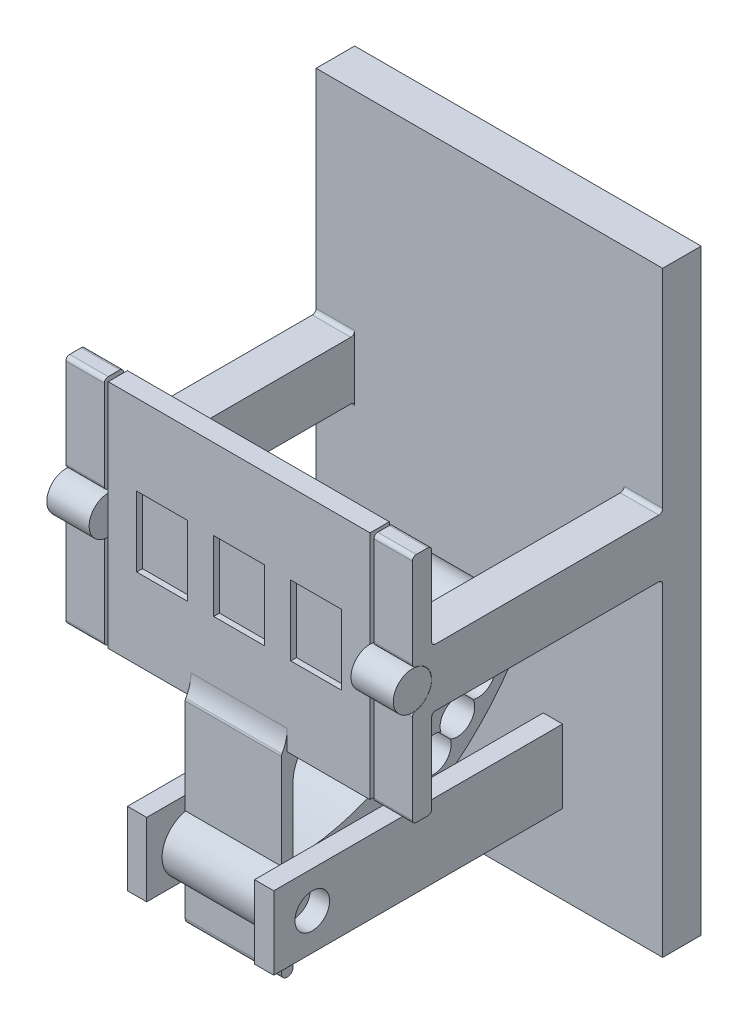
from build123d import *

# Parameters (mm, degrees)
SKETCH1_W               = 125.00000000000001
SKETCH1_H               = 90
BOSS_EXTRUDE1_DEPTH     = 10
BOSS_EXTRUDE2_DEPTH     = 35
BOSS_EXTRUDE3_DEPTH     = 45
CUT_EXTRUDE3_DEPTH      = 113.0267825120404
CUT_EXTRUDE3_DEPTH_BACK = 113.0267825120404
SKETCH11_W              = 89.99999999999999
SKETCH11_H              = 29.999999999999993
BOSS_EXTRUDE5_DEPTH     = 10
SKETCH13_W              = 68
SKETCH13_H              = 60.00000000000001
BOSS_EXTRUDE6_DEPTH     = 65
CUT_EXTRUDE6_DEPTH      = 151.5199322349037
CUT_EXTRUDE6_DEPTH_BACK = 151.5199322349037
SKETCH14_W              = 68
SKETCH14_H              = 59.999999999999986
SKETCH15_R              = 4.9499999999999975
BOSS_EXTRUDE8_DEPTH     = 11
CUT_EXTRUDE7_DEPTH      = 128.30377056474015
CUT_EXTRUDE7_DEPTH_BACK = 1.5
SKETCH17_W              = 13.199999999999998
SKETCH17_H              = 18.2
SKETCH19_R              = 4.499999999999999
BOSS_EXTRUDE10_DEPTH    = 12.5
BOSS_EXTRUDE12_DEPTH    = 12.5
BOSS_EXTRUDE13_DEPTH    = 75
SKETCH22_R              = 4.500000000000005
CUT_EXTRUDE8_DEPTH      = 75
FILLET1_R               = 10
FILLET5_R               = 1
BOSS_EXTRUDE14_DEPTH    = 12.5
BOSS_EXTRUDE16_REACH    = 167.349
SKETCH24_W              = 25.000000000000004
SKETCH24_H              = 3.000000000000014


with BuildPart() as part:
    # Sketch1 → Boss-Extrude1 (new body)
    with BuildSketch(Plane(origin=(0, 0, 0), x_dir=(0, 1, 0), z_dir=(0, 0, 1))):
        Rectangle(SKETCH1_W, SKETCH1_H)
    extrude(amount=BOSS_EXTRUDE1_DEPTH)

    # Sketch3 → Boss-Extrude2 (add, symmetric)
    with BuildSketch(Plane.YZ):
        with BuildLine():
            Line((5.916079783099619, 75), (7.5, 75))
            Line((7.5, 75), (29.144025452034434, 75))
            ThreePointArc((29.144025452034434, 75), (29.851132233220987, 74.70710678118655), (30.14402545203444, 74))
            Line((30.14402545203444, 74), (30.14402545203444, 71))
            ThreePointArc((30.14402545203444, 71), (29.851132233220998, 70.29289321881345), (29.144025452034434, 69.99999999999999))
            Line((29.144025452034434, 69.99999999999999), (8.500000000000007, 69.99999999999999))
            ThreePointArc((8.500000000000007, 69.99999999999999), (7.792893218813454, 69.70710678118654), (7.5, 68.99999999999999))
            Line((7.5, 68.99999999999999), (7.5, 0))
            Line((7.5, 0), (-7.5, 0))
            Line((-7.5, 0), (-7.5, 68.99999999999999))
            ThreePointArc((-7.5, 68.99999999999999), (-7.792893218813454, 69.70710678118654), (-8.500000000000007, 69.99999999999999))
            Line((-8.500000000000007, 69.99999999999999), (-29.144025452034434, 69.99999999999999))
            ThreePointArc((-29.144025452034434, 69.99999999999999), (-29.851132233220994, 70.29289321881345), (-30.14402545203444, 71))
            Line((-30.14402545203444, 71), (-30.14402545203444, 74))
            ThreePointArc((-30.14402545203444, 74), (-29.851132233220987, 74.70710678118655), (-29.144025452034434, 75))
            Line((-29.144025452034434, 75), (-7.5, 75))
            Line((-7.5, 75), (-5.916079783099619, 75))
            ThreePointArc((-5.916079783099619, 75), (-5.2705825587317126, 74.76376261582597), (-4.930066485916348, 74.16666666666666))
            ThreePointArc((-4.930066485916348, 74.16666666666666), (3.1e-16, 70), (4.930066485916348, 74.16666666666666))
            ThreePointArc((4.930066485916348, 74.16666666666666), (5.2705825587317126, 74.76376261582597), (5.916079783099619, 75))
        make_face()
    extrude(amount=BOSS_EXTRUDE2_DEPTH, both=True)

    # Sketch5 → Boss-Extrude3 (add, symmetric)
    with BuildSketch(Plane.YZ):
        with BuildLine():
            ThreePointArc((-7.5, 68.99999999999999), (-7.792893218813455, 69.70710678118654), (-8.500000000000007, 69.99999999999999))
            Line((-8.500000000000007, 69.99999999999999), (-29.144025452034434, 69.99999999999999))
            ThreePointArc((-29.144025452034434, 69.99999999999999), (-29.851132233220987, 70.29289321881345), (-30.14402545203444, 71))
            Line((-30.14402545203444, 71), (-30.14402545203444, 74))
            ThreePointArc((-30.14402545203444, 74), (-29.851132233220987, 74.70710678118655), (-29.14402545203444, 75))
            Line((-29.14402545203444, 75), (-5.916079783099619, 75))
            ThreePointArc((-5.916079783099619, 75), (-5.2705825587317126, 74.76376261582597), (-4.930066485916349, 74.16666666666666))
            ThreePointArc((-4.930066485916349, 74.16666666666666), (3.1e-16, 70), (4.930066485916347, 74.16666666666666))
            ThreePointArc((4.930066485916347, 74.16666666666666), (5.2705825587317126, 74.76376261582597), (5.916079783099619, 75))
            Line((5.916079783099619, 75), (29.144025452034434, 75))
            ThreePointArc((29.144025452034434, 75), (29.851132233220987, 74.70710678118655), (30.14402545203444, 74))
            Line((30.14402545203444, 74), (30.14402545203444, 71))
            ThreePointArc((30.14402545203444, 71), (29.851132233220998, 70.29289321881345), (29.144025452034434, 69.99999999999999))
            Line((29.144025452034434, 69.99999999999999), (8.500000000000007, 69.99999999999999))
            ThreePointArc((8.500000000000007, 69.99999999999999), (7.792893218813454, 69.70710678118654), (7.499999999999999, 68.99999999999999))
            Line((7.499999999999999, 68.99999999999999), (7.5, 11.000000000000009))
            ThreePointArc((7.5, 11.000000000000009), (7.79289321881345, 10.292893218813452), (8.500000000000007, 10))
            Line((8.500000000000007, 10), (-8.500000000000007, 10))
            ThreePointArc((-8.500000000000007, 10), (-7.79289321881345, 10.292893218813452), (-7.5, 11.000000000000009))
            Line((-7.5, 11.000000000000009), (-7.5, 68.99999999999999))
        make_face()
    extrude(amount=BOSS_EXTRUDE3_DEPTH, both=True)

    # Sketch7 → Cut-Extrude3 (cut, two sides: drawn at the far end of the back side and taken through both)
    with BuildSketch(Plane(origin=(0, 7.5, 0), x_dir=(-1, 0, 0), z_dir=(0, 1, 0)).offset(-CUT_EXTRUDE3_DEPTH_BACK)):
        Polygon((-35.000000000000014, 11.000000000000009), (-1.421e-14, 11.000000000000009), (-1.388e-14, 68.99999999999999), (-35, 68.99999999999999), align=None)
        Polygon((-1.388e-14, 68.99999999999999), (-1.388e-14, 11.000000000000009), (35, 11.000000000000009), (34.99999999999999, 68.99999999999999), align=None)
        Polygon((-35.000000000000014, 10.000000000000002), (-1.421e-14, 10.000000000000002), (-1.388e-14, 11.000000000000009), (-35.000000000000014, 11.000000000000009), align=None)
        Polygon((-1.388e-14, 11.000000000000009), (-1.388e-14, 10), (34.999999999999986, 10.000000000000002), (34.99999999999999, 11.000000000000009), align=None)
        Polygon((-35, 68.99999999999999), (-1.421e-14, 68.99999999999999), (-1.388e-14, 75), (-35, 75), align=None)
        Polygon((-1.388e-14, 75), (-1.388e-14, 68.99999999999999), (34.99999999999999, 68.99999999999999), (34.99999999999999, 75.00000000000001), align=None)
    extrude(amount=CUT_EXTRUDE3_DEPTH + CUT_EXTRUDE3_DEPTH_BACK, mode=Mode.SUBTRACT)

    # Sketch11 → Boss-Extrude5 (add)
    with BuildSketch(Plane.XY.offset(10)):
        with Locations((-7.11e-15, -77.5)):
            Rectangle(SKETCH11_W, SKETCH11_H)
    extrude(amount=-BOSS_EXTRUDE5_DEPTH)

    # Sketch13 → Boss-Extrude6 (add)
    with BuildSketch(Plane.XY.offset(10)):
        Rectangle(SKETCH13_W, SKETCH13_H)
    extrude(amount=BOSS_EXTRUDE6_DEPTH)

    # Sketch14 → Cut-Extrude6 (cut, two sides: drawn at the far end of the back side and taken through both)
    with BuildSketch(Plane(origin=(0, 30, 0), x_dir=(-1, 0, 0), z_dir=(0, 1, 0)).offset(-CUT_EXTRUDE6_DEPTH_BACK)):
        with Locations((0, 39.99999999999999)):
            Rectangle(SKETCH14_W, SKETCH14_H)
    extrude(amount=CUT_EXTRUDE6_DEPTH + CUT_EXTRUDE6_DEPTH_BACK, mode=Mode.SUBTRACT)


with BuildPart() as cut_extrude6_piece_1:
    # of the separate pieces the step leaves, piece 1, a body of its own (cut_extrude6_pieces)
    add(part.part.solids().sort_by_distance((45, -8.5, 10))[0])

    # Sketch21 → Boss-Extrude13 (add)
    with BuildSketch(Plane.XY.offset(10)):
        Polygon((14, -67), (14, -58), (14, -53.00000000000001), (19, -53.00000000000001), (19, -72.00000000000001), (14, -72.00000000000001), align=None)
    boss_extrude13 = extrude(amount=BOSS_EXTRUDE13_DEPTH)

    # Sketch22 → Cut-Extrude8 (cut)
    with BuildSketch(Plane(origin=(14, 0, 0), x_dir=(0, -1, 0), z_dir=(-1, 0, 0))):
        with Locations(Location((62.5, 75, 0), (0, 0, 90))):
            Circle(SKETCH22_R)
    cut_extrude8 = extrude(amount=-CUT_EXTRUDE8_DEPTH, mode=Mode.SUBTRACT)

    # Mirror3: Boss-Extrude13, Cut-Extrude8 across plane
    add(boss_extrude13.mirror(Plane(origin=(0, 0, 0), x_dir=(0, 0, 1), z_dir=(1, 0, 0))))
    add(cut_extrude8.mirror(Plane(origin=(0, 0, 0), x_dir=(0, 0, 1), z_dir=(1, 0, 0))), mode=Mode.SUBTRACT)


with BuildPart() as cut_extrude6_piece_2:
    # of the separate pieces the step leaves, piece 2, a body of its own (cut_extrude6_pieces)
    add(part.part.solids().sort_by_distance((34, 30, 70))[0])

    # Sketch15 → Boss-Extrude8 (add)
    with BuildSketch(Plane.YZ.offset(34)):
        with Locations(Location((0, 75, 0), (0, 0, 180))):
            Circle(SKETCH15_R)
    boss_extrude8 = extrude(amount=BOSS_EXTRUDE8_DEPTH)

    # Mirror2: Boss-Extrude8 across plane
    add(boss_extrude8.mirror(Plane(origin=(0, 0, 0), x_dir=(0, 0, 1), z_dir=(1, 0, 0))))

    # Sketch17 → Cut-Extrude7 (cut, two sides: drawn at the far end of the back side and taken through both)
    with BuildSketch(Plane.XY.offset(75).offset(-CUT_EXTRUDE7_DEPTH_BACK)):
        with Locations((20, 0)):
            Rectangle(SKETCH17_W, SKETCH17_H)
        Rectangle(SKETCH17_W, SKETCH17_H)
        with Locations((-20, 0)):
            Rectangle(SKETCH17_W, SKETCH17_H)
    extrude(amount=CUT_EXTRUDE7_DEPTH + CUT_EXTRUDE7_DEPTH_BACK, mode=Mode.SUBTRACT)



with BuildPart() as body_3:
    # Sketch19 → Boss-Extrude10 (new, symmetric)
    with BuildSketch(Plane.YZ):
        with BuildLine():
            ThreePointArc((-27.500000000000195, 27.368602791855984), (-47.63139720814418, 47.5000000000001), (-54.999999999999986, 75))
            ThreePointArc((-54.99999999999999, 75), (-62.500000000000234, 82.5), (-70, 74.99999999999952))
            ThreePointArc((-70.00000000000001, 74.99999999999952), (-60.62177826491066, 39.999999999999915), (-35.00000000000025, 14.378221735089447))
            ThreePointArc((-35.00000000000025, 14.378221735089461), (-24.75480947161695, 17.1234122634727), (-27.5000000000002, 27.368602791855995))
        make_face()
        with BuildLine():
            ThreePointArc((-53.420151070749036, 39.305796220104114), (-57.549230355616196, 46.67156079895663), (-49.62658773652759, 43.75000000000031))
            ThreePointArc((-49.62658773652759, 43.75000000000031), (-49.79588035427119, 42.52730888231364), (-50.29102043398087, 41.396614466851425))
            ThreePointArc((-50.291020433980876, 41.39661446685144), (-46.66302296924606, 40.37505330604382), (-45.08458376820239, 36.95241068695523))
            ThreePointArc((-45.08458376820239, 36.95241068695523), (-45.18318093770394, 36.01557925938665), (-45.47465182317137, 35.11980068828845))
            ThreePointArc((-45.47465182317139, 35.119800688288485), (-41.50271984866162, 34.41221987284317), (-39.69417382415946, 30.805826175841016))
            ThreePointArc((-39.69417382415946, 30.805826175841016), (-39.740923028054816, 30.158866094388294), (-39.88019931171205, 29.5253481768289))
            ThreePointArc((-39.88019931171212, 29.52534817682898), (-35.59776738012861, 29.19011787523953), (-33.547589313045286, 25.415416231797977))
            ThreePointArc((-33.547589313045286, 25.415416231797977), (-33.56156005491885, 25.06109787885311), (-33.603385533149094, 24.708979566019387))
            ThreePointArc((-33.603385533149144, 24.70897956601943), (-29.052300623284896, 24.80025800141369), (-26.75000000000022, 20.87341226347273))
            ThreePointArc((-26.75000000000022, 20.87341226347273), (-31.604318352945057, 16.387383005346287), (-35.69420377989643, 21.579848929251266))
            ThreePointArc((-35.694203779896405, 21.579848929251252), (-40.787015743584554, 21.845326200487442), (-42.36156382549272, 26.695894230810016))
            ThreePointArc((-42.36156382549269, 26.695894230809987), (-47.37615433949895, 27.62384566050158), (-48.304105769190464, 32.63843617450786))
            ThreePointArc((-48.304105769190386, 32.63843617450779), (-53.154673799512956, 34.21298425641601), (-53.420151070749085, 39.30579622010416))
        make_face(mode=Mode.SUBTRACT)
        with Locations(Location((-62.5, 75, 0), (0, 0, 270))):
            Circle(SKETCH19_R, mode=Mode.SUBTRACT)
    extrude(amount=BOSS_EXTRUDE10_DEPTH, both=True)


with BuildPart() as cut_extrude6_piece_2_1:
    add(cut_extrude6_piece_2.part)

    add(body_3.part)  # Boss-Extrude12 merges body 3
    # Sketch20 → Boss-Extrude12 (add, symmetric)
    with BuildSketch(Plane.YZ):
        Polygon((-55.000000000000014, 74.9999999999996), (-30, 75), (-30, 76.49999999999999), (-55.000000000000014, 76.49999999999999), align=None)
        Polygon((-30, 73.49999999999999), (-30, 75), (-55.000000000000014, 74.9999999999996), (-55.000000000000014, 73.49999999999999), align=None)
    extrude(amount=BOSS_EXTRUDE12_DEPTH, both=True)

    # Fillet1
    # the kernel refuses this fillet: 10 mm, written as the material it adds along each edge
    with BuildSketch(Plane(origin=(-12.5, -30, 75), x_dir=(0, 1, 0), z_dir=(1, 0, 0))) as fillet1_piece_1:
        with BuildLine():
            CenterArc((5.267826876426348, 10), FILLET1_R, 238.21166938294851, 31.788330617051486)
            Line((0, 1.4999999999999858), (0, 0))
            Line((0, 0), (5.267826876426348, 0))
        make_face()
    extrude(amount=25)
    with BuildSketch(Plane(origin=(12.5, -30, 73.49999999999999), x_dir=(0, 0, -1), z_dir=(-1, 0, 0))) as fillet1_piece_2:
        with BuildLine():
            CenterArc((10, 7.599342076785334), FILLET1_R, 180, 49.45839812649547)
            Line((0, 7.599342076785334), (0, 0))
            Line((0, 0), (3.5, 0))
        make_face()
    extrude(amount=25)

    # Fillet5
    fillet5_edges = [cut_extrude6_piece_2_1.edges().sort_by_distance(p)[0] for p in [
        (0, -30, 76.49999999999999),
    ]]
    fillet(fillet5_edges, radius=FILLET5_R)

    # Sketch24 → Boss-Extrude16 (add, up to next)
    with BuildSketch(Plane(origin=(0, -72.00000000000001, 0), x_dir=(-1, 0, 0), z_dir=(0, 1, 0)), mode=Mode.PRIVATE) as boss_extrude16_sk1:
        with Locations((0, 74.99999999999997)):
            Rectangle(SKETCH24_W, SKETCH24_H)
    boss_extrude16_tool1 = extrude(boss_extrude16_sk1.sketch, amount=BOSS_EXTRUDE16_REACH, mode=Mode.PRIVATE) - cut_extrude6_piece_2_1.part


with BuildPart() as body_3_2:
    # Sketch23 → Boss-Extrude14 (new, symmetric)
    with BuildSketch(Plane.YZ):
        with BuildLine():
            Line((-72.00000000000001, 76.49999999999999), (-79.19025615629191, 76.49999999999999))
            ThreePointArc((-79.19025615629191, 76.49999999999999), (-80.69025615629191, 74.99999999999999), (-79.19025615629191, 73.49999999999997))
            Line((-79.19025615629191, 73.49999999999997), (-72.00000000000001, 73.49999999999997))
            Line((-72.00000000000001, 73.49999999999997), (-72.00000000000001, 76.49999999999999))
        make_face()
    extrude(amount=BOSS_EXTRUDE14_DEPTH, both=True)


with BuildPart() as cut_extrude6_piece_2_2:
    add(cut_extrude6_piece_2_1.part)

    add(body_3_2.part)  # Boss-Extrude16 merges body 3 2
    add(boss_extrude16_tool1.solids().sort_by_distance((0, -72, 75))[0])


solid = Compound([cut_extrude6_piece_1.part, cut_extrude6_piece_2_2.part])
